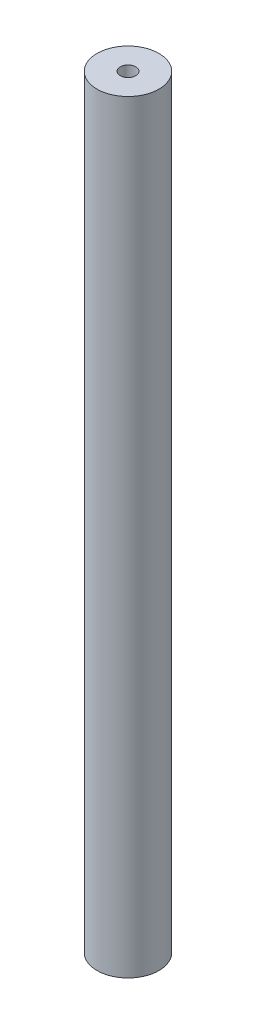
from build123d import *

# Parameters (mm, degrees)
SKETCH1_R           = 6
BOSS_EXTRUDE1_DEPTH = 148
SKETCH2_R           = 1.5
CUT_EXTRUDE1_DEPTH  = 5
LPATTERN1_COUNT     = 2
LPATTERN1_PITCH     = 143


with BuildPart() as part:
    # Sketch1 → Boss-Extrude1 (new body)
    with BuildSketch(Plane(origin=(0, 0, 0), x_dir=(1, 0, 0), z_dir=(0, 1, 0))):
        Circle(SKETCH1_R)
    extrude(amount=BOSS_EXTRUDE1_DEPTH)

    # Sketch2 → Cut-Extrude1 (cut)
    with BuildSketch(Plane(origin=(0, 148, 0), x_dir=(1, 0, 0), z_dir=(0, 1, 0))):
        Circle(SKETCH2_R)
    cut_extrude1 = extrude(amount=-CUT_EXTRUDE1_DEPTH, mode=Mode.SUBTRACT)

    # LPattern1: Cut-Extrude1 ×2
    with Locations(*[(0, -i * LPATTERN1_PITCH, 0) for i in range(1, LPATTERN1_COUNT)]):
        add(cut_extrude1, mode=Mode.SUBTRACT)


solid = part.part
